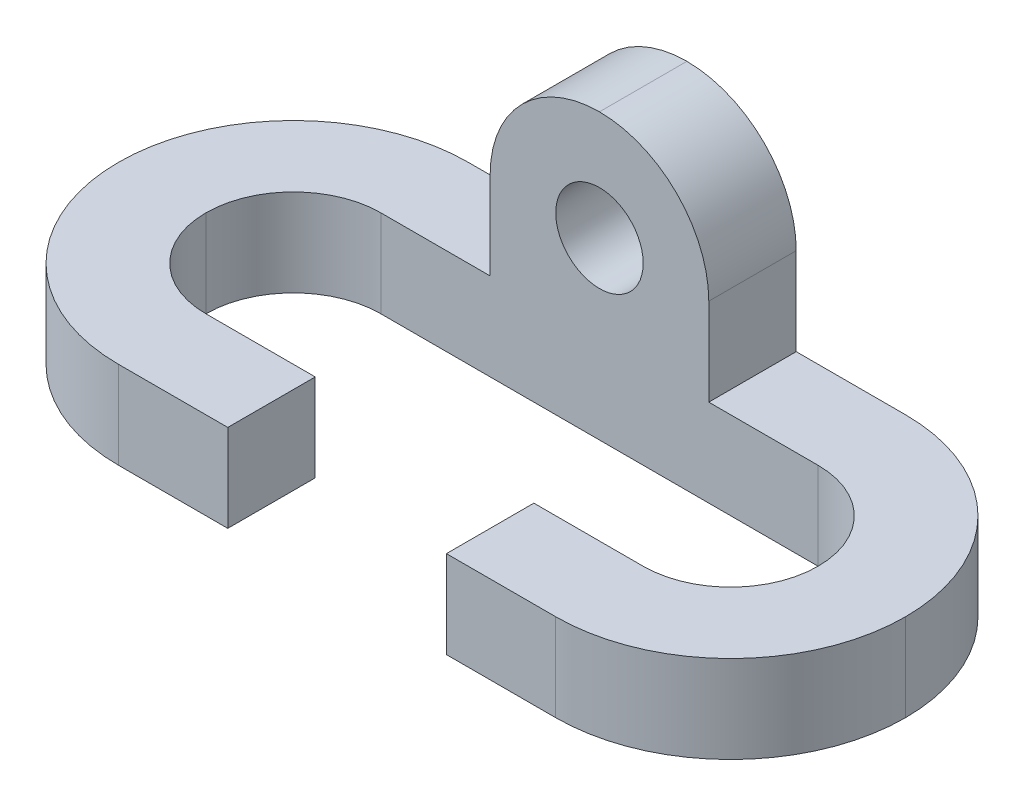
from build123d import *

# Parameters (mm, degrees)
SKETCH2_W           = 114.3
SKETCH2_H           = 50.8
SKETCH2_W_2         = 88.9
SKETCH2_H_2         = 25.4
BOSS_EXTRUDE1_DEPTH = 12.7
FILLET3_R           = 25.4
FILLET4_R           = 12.7
SKETCH5_W           = 31.75
SKETCH5_H           = 12.7
BOSS_EXTRUDE2_DEPTH = 28.575
FILLET5_R           = 15.875
SKETCH6_R           = 6.35
CUT_EXTRUDE1_DEPTH  = 124.825
SKETCH7_W           = 31.75
SKETCH7_H           = 12.7
CUT_EXTRUDE2_DEPTH  = 129.30300318


with BuildPart() as part:
    # Sketch2 → Boss-Extrude1 (new body)
    with BuildSketch(Plane(origin=(0, 0, 0), x_dir=(1, 0, 0), z_dir=(0, 1, 0))):
        with Locations((57.15, 25.4)):
            Rectangle(SKETCH2_W, SKETCH2_H)
        with Locations((57.15, 25.4)):
            Rectangle(SKETCH2_W_2, SKETCH2_H_2, mode=Mode.SUBTRACT)
    extrude(amount=-BOSS_EXTRUDE1_DEPTH)

    # Fillet3
    fillet3_edges = [part.edges().sort_by_distance(p)[0] for p in [
        (0, -6.35, 0),
        (0, -6.35, -50.8),
        (114.3, -6.35, -50.8),
        (114.3, -6.35, 0),
    ]]
    fillet(fillet3_edges, radius=FILLET3_R - 0.0001)  # a hair under: the kernel refuses the full size

    # Fillet4
    fillet4_edges = [part.edges().sort_by_distance(p)[0] for p in [
        (12.7, -6.35, -12.7),
        (101.6, -6.35, -12.7),
        (101.6, -6.35, -38.1),
        (12.7, -6.35, -38.1),
    ]]
    fillet(fillet4_edges, radius=FILLET4_R - 0.0001)  # a hair under: the kernel refuses the full size

    # Sketch5 → Boss-Extrude2 (add)
    with BuildSketch(Plane(origin=(0, 0, 0), x_dir=(1, 0, 0), z_dir=(0, 1, 0))):
        with Locations((57.15, 44.45)):
            Rectangle(SKETCH5_W, SKETCH5_H)
    extrude(amount=BOSS_EXTRUDE2_DEPTH)

    # Fillet5
    fillet5_edges = [part.edges().sort_by_distance(p)[0] for p in [
        (41.275, 28.575, -44.45),
        (73.025, 28.575, -44.45),
    ]]
    fillet(fillet5_edges, radius=FILLET5_R - 0.0001)  # a hair under: the kernel refuses the full size

    # Sketch6 → Cut-Extrude1 (cut, through all)
    with BuildSketch(Plane.XY.offset(-38.1)):
        with Locations((57.15, 12.7)):
            Circle(SKETCH6_R)
    extrude(amount=-CUT_EXTRUDE1_DEPTH, mode=Mode.SUBTRACT)

    # Sketch7 → Cut-Extrude2 (cut, through all)
    with BuildSketch(Plane(origin=(0, 0, 0), x_dir=(1, 0, 0), z_dir=(0, 1, 0))):
        with Locations((57.15, 6.35)):
            Rectangle(SKETCH7_W, SKETCH7_H)
    extrude(amount=-CUT_EXTRUDE2_DEPTH, mode=Mode.SUBTRACT)


solid = part.part
